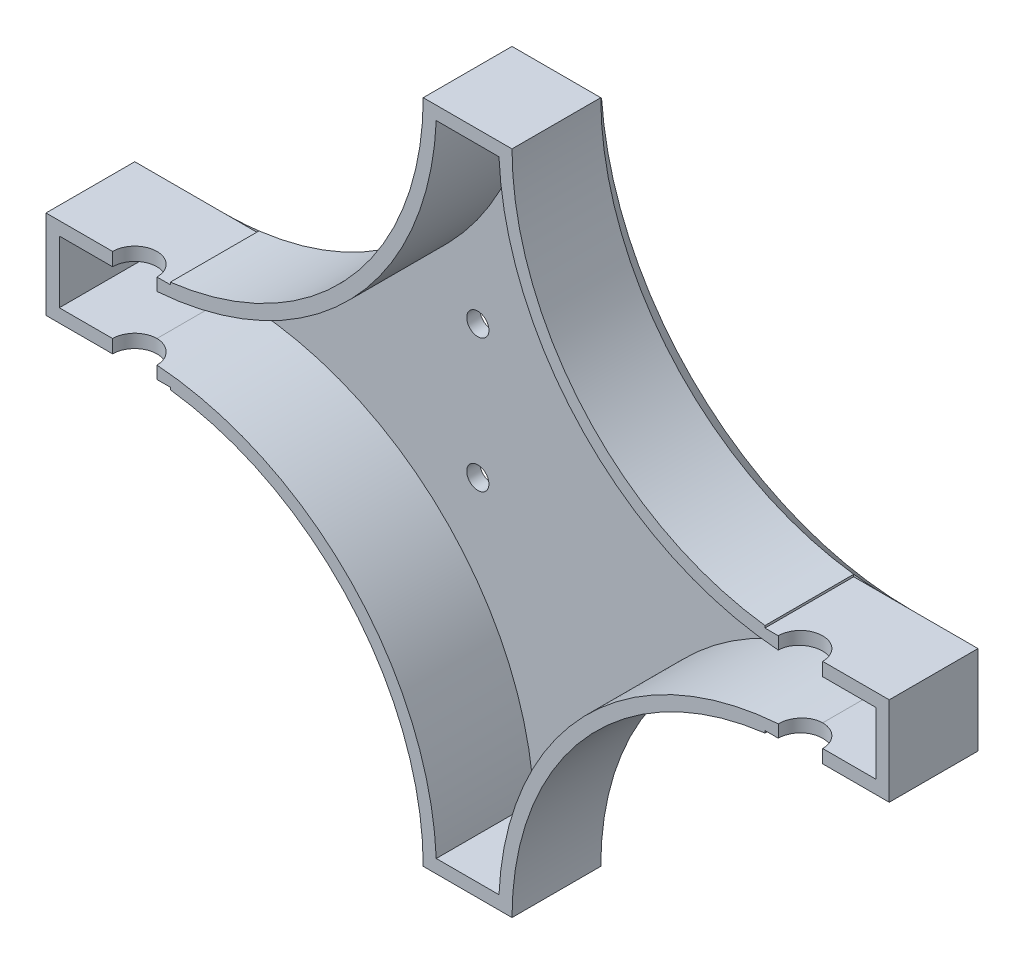
from build123d import *
from build123d.topology import SkipClean

# Parameters (mm, degrees)
SKETCH1_W               = 200
SKETCH1_H               = 150
BOSS_EXTRUDE1_DEPTH     = 25
CUT_EXTRUDE2_DEPTH      = 30
SHELL2_T                = -3
SKETCH6_R               = 2.5
CUT_EXTRUDE3_DEPTH      = 30
CUT_EXTRUDE4_DEPTH      = 30
CUT_EXTRUDE4_DEPTH_BACK = 30
SKETCH7_R               = 5
CHAMFER1_SIZE           = 5
SKETCH8_R               = 2.5
CUT_EXTRUDE5_DEPTH      = 10
SKETCH9_W               = 105
SKETCH9_H               = 150
CUT_EXTRUDE8_DEPTH      = 50
SKETCH10_R              = 2.5
CUT_EXTRUDE9_DEPTH      = 50
SKETCH11_W              = 20
SKETCH11_H              = 2.690986913
SKETCH11_W_2            = 20.020411306
SKETCH11_H_2            = 2.771183394
CUT_EXTRUDE10_DEPTH     = 28
SKETCH12_W              = 20
SKETCH12_H              = 3.926823093
CUT_EXTRUDE11_DEPTH     = 28
SKETCH_1_W              = 25
SKETCH_1_H              = 25
EXTRUDE_1_DEPTH         = 5
CHAMFER_1_SIZE          = 2
SKETCH_2_R              = 4
EXTRUDE_2_DEPTH         = 5
CHAMFER_4_SIZE          = 1


with BuildPart() as part:
    # Sketch1 → Boss-Extrude1 (new body)
    with BuildSketch(Plane.XY):
        Rectangle(SKETCH1_W, SKETCH1_H)
    extrude(amount=BOSS_EXTRUDE1_DEPTH)

    # Sketch5 → Cut-Extrude2 (cut)
    with BuildSketch(Plane(origin=(0, 0, 0), x_dir=(-1, 0, 0), z_dir=(0, 0, -1))):
        with BuildLine():
            Line((100, 75), (5, 75))
            ThreePointArc((5, 75), (24.038059223, 29.038059223), (70, 10))
            Line((70, 10), (100, 10))
            Line((100, 10), (100, 75))
        make_face()
        with BuildLine():
            ThreePointArc((70, -10), (24.038059223, -29.038059223), (5, -75))
            Line((5, -75), (100, -75))
            Line((100, -75), (100, -10))
            Line((100, -10), (70, -10))
        make_face()
        with BuildLine():
            Line((-80, -10), (-100, -10))
            Line((-100, -10), (-100, -75))
            Line((-100, -75), (-15, -75))
            ThreePointArc((-15, -75), (-34.038059223, -29.038059223), (-80, -10))
        make_face()
        with BuildLine():
            Line((-100, 75), (-100, 10))
            Line((-100, 10), (-80, 10))
            ThreePointArc((-80, 10), (-34.038059223, 29.038059223), (-15, 75))
            Line((-15, 75), (-100, 75))
        make_face()
    extrude(amount=-CUT_EXTRUDE2_DEPTH, mode=Mode.SUBTRACT)

    # Shell2
    shell2_openings = [part.faces().sort_by_distance(p)[0] for p in [
        (3.044348512, 0, 25),
    ]]
    offset(amount=SHELL2_T, openings=shell2_openings, kind=Kind.INTERSECTION)

    # Sketch6 → Cut-Extrude3 (cut)
    with BuildSketch(Plane(origin=(0, 0, 0), x_dir=(-1, 0, 0), z_dir=(0, 0, -1))):
        with Locations((-5, 65)):
            Circle(SKETCH6_R)
        with Locations((-5, -65)):
            Circle(SKETCH6_R)
    extrude(amount=-CUT_EXTRUDE3_DEPTH, mode=Mode.SUBTRACT)

    # Sketch7 → Cut-Extrude4 (cut, two sides: drawn at the far end of the back side and taken through both)
    with BuildSketch(Plane(origin=(0, 0, 0), x_dir=(1, 0, 0), z_dir=(0, 1, 0)).offset(-CUT_EXTRUDE4_DEPTH_BACK)):
        with Locations((-80, -25)):
            Circle(SKETCH7_R)
        with Locations((80, -25)):
            Circle(SKETCH7_R)
    extrude(amount=CUT_EXTRUDE4_DEPTH + CUT_EXTRUDE4_DEPTH_BACK, mode=Mode.SUBTRACT)

    # Chamfer1
    chamfer1_edges = [part.edges().sort_by_distance(p)[0] for p in [
        (-100, 0, 0),
        (5, 75, 0),
        (100, 0, 0),
        (5, -75, 0),
        (90, 10, 0),
        (34.038059223, 29.038059223, 0),
        (34.038059223, -29.038059223, 0),
        (90, -10, 0),
        (-24.038059223, -29.038059223, 0),
        (-85, -10, 0),
        (-24.038059223, 29.038059223, 0),
        (-85, 10, 0),
    ]]
    chamfer(chamfer1_edges, length=CHAMFER1_SIZE)

    # Sketch8 → Cut-Extrude5 (cut)
    with BuildSketch(Plane.XY.offset(3)):
        with Locations((-22, 15)):
            Circle(SKETCH8_R)
        with Locations((-22, -15)):
            Circle(SKETCH8_R)
    extrude(amount=-CUT_EXTRUDE5_DEPTH, mode=Mode.SUBTRACT)

    # Sketch9 → Cut-Extrude8 (cut)
    with BuildSketch(Plane.XY):
        with Locations((-47.5, 0)):
            Rectangle(SKETCH9_W, SKETCH9_H)
    extrude(amount=CUT_EXTRUDE8_DEPTH, mode=Mode.SUBTRACT)

    # Mirror4: part across plane


with BuildPart() as part_1:
    with SkipClean():  # the faces are left unmerged after this step: merging them gives an invalid solid
        add(part.part)
        add(part.part.mirror(Plane(origin=(5, 75, 50), x_dir=(0, 0, 1), z_dir=(-1, 0, 0))))

    # Sketch10 → Cut-Extrude9 (cut)
    with SkipClean():  # the faces are left unmerged after this step: merging them gives an invalid solid
        with BuildSketch(Plane.XY):
            with Locations((-14.7, 15)):
                Circle(SKETCH10_R)
            with Locations((-14.7, -15)):
                Circle(SKETCH10_R)
        extrude(amount=CUT_EXTRUDE9_DEPTH, mode=Mode.SUBTRACT)

    # Sketch11 → Cut-Extrude10 (cut)
    with SkipClean():  # the faces are left unmerged after this step: merging them gives an invalid solid
        with BuildSketch(Plane.ZY.offset(90)):
            with Locations((15, 11.345493457)):
                Rectangle(SKETCH11_W, SKETCH11_H)
            with Locations((15.010205653, -11.385591697)):
                Rectangle(SKETCH11_W_2, SKETCH11_H_2)
        extrude(amount=-CUT_EXTRUDE10_DEPTH, mode=Mode.SUBTRACT)

    # Sketch12 → Cut-Extrude11 (cut)
    with SkipClean():  # the faces are left unmerged after this step: merging them gives an invalid solid
        with BuildSketch(Plane(origin=(100, 0, 0), x_dir=(0, 0, -1), z_dir=(1, 0, 0))):
            with Locations((-15, 11.963411547)):
                Rectangle(SKETCH12_W, SKETCH12_H)
            with Locations((-15, -11.963411547)):
                Rectangle(SKETCH12_W, SKETCH12_H)
        extrude(amount=-CUT_EXTRUDE11_DEPTH, mode=Mode.SUBTRACT)

    # 草图1 → 凸台-拉伸1 (add)
    with SkipClean():  # the faces are left unmerged after this step: merging them gives an invalid solid
        with BuildSketch(Plane.XY.offset(3)):
            with Locations((12, 0.193209558)):
                Rectangle(SKETCH_1_W, SKETCH_1_H)
        extrude(amount=-EXTRUDE_1_DEPTH)

    # 倒角1
    chamfer_1_edges = [part_1.edges().sort_by_distance(p)[0] for p in [
        (12, 12.693209558, -2),
        (-0.5, 0.193209558, -2),
        (12, -12.306790442, -2),
        (24.5, 0.193209558, -2),
    ]]
    chamfer(chamfer_1_edges, length=CHAMFER_1_SIZE - 0.0001)  # a hair under: the kernel refuses the full size

    # 草图2 → 凸台-拉伸2 (add)
    with BuildSketch(Plane(origin=(0, 0, -2), x_dir=(-1, 0, 0), z_dir=(0, 0, -1))):
        with Locations(Location((-17, 5.693209558, 0), (0, 0, 180))):
            Circle(SKETCH_2_R)
        with Locations(Location((-7, 5.693209558, 0), (0, 0, 180))):
            Circle(SKETCH_2_R)
        with Locations(Location((-17, -5.306790442, 0), (0, 0, 180))):
            Circle(SKETCH_2_R)
        with Locations(Location((-7, -5.306790442, 0), (0, 0, 180))):
            Circle(SKETCH_2_R)
    extrude(amount=EXTRUDE_2_DEPTH)

    # 倒角4
    chamfer_4_edges = [part_1.edges().sort_by_distance(p)[0] for p in [
        (13, 5.693209558, -7),
        (13, -5.306790442, -7),
        (3, 5.693209558, -7),
        (3, -5.306790442, -7),
    ]]
    chamfer(chamfer_4_edges, length=CHAMFER_4_SIZE)


solid = part_1.part
